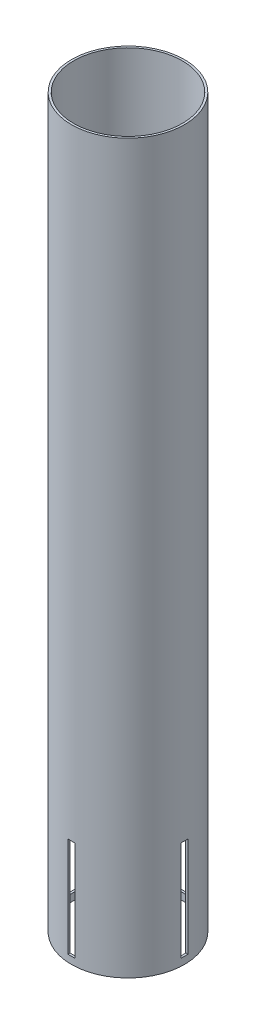
from build123d import *

# Parameters (mm, degrees)
SKETCH1_R           = 39.6
SKETCH1_R_2         = 38.1
BOSS_EXTRUDE1_DEPTH = 510
SKETCH2_W           = 5
SKETCH2_H           = 70
CUT_EXTRUDE1_DEPTH  = 514.06560984
CIRPATTERN1_COUNT   = 4


with BuildPart() as part:
    # Sketch1 → Boss-Extrude1 (new body)
    with BuildSketch(Plane(origin=(0, 0, 0), x_dir=(1, 0, 0), z_dir=(0, 1, 0))):
        Circle(SKETCH1_R)
        Circle(SKETCH1_R_2, mode=Mode.SUBTRACT)
    extrude(amount=BOSS_EXTRUDE1_DEPTH)

    # Sketch2 → Cut-Extrude1 (cut, through all)
    with BuildSketch(Plane.XY):
        with Locations((0, 40)):
            Rectangle(SKETCH2_W, SKETCH2_H)
    cut_extrude1 = extrude(amount=-CUT_EXTRUDE1_DEPTH, mode=Mode.SUBTRACT)

    # CirPattern1: Cut-Extrude1 ×4 about axis
    cirpattern1_axis = Axis((0, 0, 0), (0, 1, 0))
    for i in range(1, CIRPATTERN1_COUNT):
        add(cut_extrude1.rotate(cirpattern1_axis, i * 360 / CIRPATTERN1_COUNT), mode=Mode.SUBTRACT)


solid = part.part
